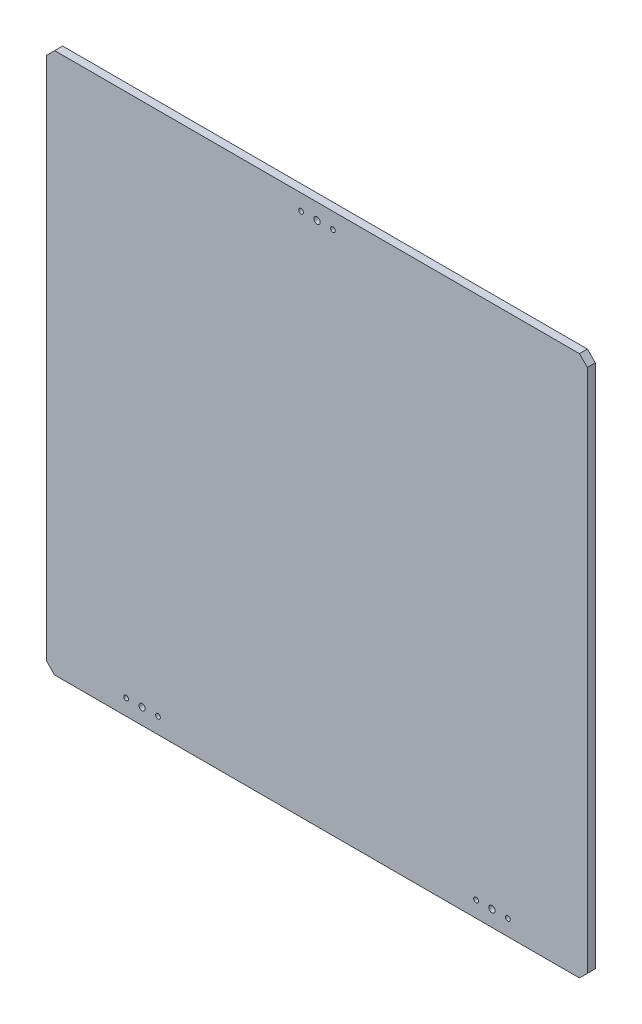
from build123d import *

# Parameters (mm, degrees)
SKETCH1_W           = 340
SKETCH1_H           = 340
BOSS_EXTRUDE1_DEPTH = 5
SKETCH3_R           = 1.5
SKETCH3_R_2         = 2
CUT_EXTRUDE2_DEPTH  = 241.468293128
CHAMFER1_SIZE       = 5


with BuildPart() as part:
    # Sketch1 → Boss-Extrude1 (new body)
    with BuildSketch(Plane.XY):
        Rectangle(SKETCH1_W, SKETCH1_H)
    extrude(amount=BOSS_EXTRUDE1_DEPTH)

    # Sketch3 → Cut-Extrude2 (cut, through all)
    with BuildSketch(Plane.XY.offset(5)):
        with Locations((-120, -160)):
            Circle(SKETCH3_R)
        with Locations((-110, -160)):
            Circle(SKETCH3_R_2)
        with Locations((-100, -160)):
            Circle(SKETCH3_R)
        with Locations((-10, 160)):
            Circle(SKETCH3_R)
        with Locations((0, 160)):
            Circle(SKETCH3_R_2)
        with Locations((10, 160)):
            Circle(SKETCH3_R)
    cut_extrude2 = extrude(amount=-CUT_EXTRUDE2_DEPTH, mode=Mode.SUBTRACT)

    # Mirror1: Cut-Extrude2 across plane
    add(cut_extrude2.mirror(Plane(origin=(0, 0, 0), x_dir=(0, 0, 1), z_dir=(1, 0, 0))), mode=Mode.SUBTRACT)

    # Chamfer1
    chamfer1_edges = [part.edges().sort_by_distance(p)[0] for p in [
        (-170, -170, 2.5),
        (170, -170, 2.5),
        (170, 170, 2.5),
        (-170, 170, 2.5),
    ]]
    chamfer(chamfer1_edges, length=CHAMFER1_SIZE)


solid = part.part
